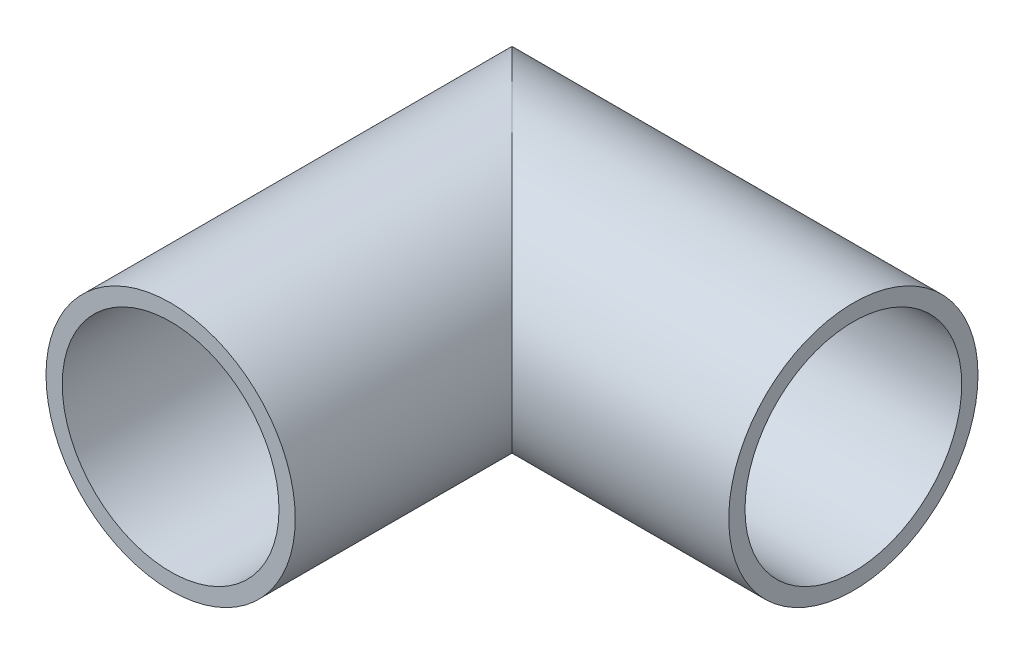
from build123d import *

# Parameters (mm, degrees)
SKETCH3_R                = 14.605
BOSS_EXTRUDE2_DEPTH      = 40.005
SKETCH4_R                = 14.605
BOSS_EXTRUDE3_DEPTH      = 40.005
BOSS_EXTRUDE4_REACH      = 60.43
BOSS_EXTRUDE4_END_RADIUS = 14.605
SKETCH5_R                = 14.605
SKETCH6_R                = 12.7
CUT_EXTRUDE1_DEPTH       = 40.005
SKETCH7_R                = 12.7
CUT_EXTRUDE2_DEPTH       = 40.005
CUT_EXTRUDE3_REACH       = 60.43
CUT_EXTRUDE3_END_RADIUS  = 12.7
SKETCH8_R                = 12.7


with BuildPart() as part:
    # Sketch3 → Boss-Extrude2 (new body)
    with BuildSketch(Plane.XY):
        Circle(SKETCH3_R)
    extrude(amount=BOSS_EXTRUDE2_DEPTH)

    # Sketch4 → Boss-Extrude3 (add)
    with BuildSketch(Plane(origin=(0, 0, 0), x_dir=(0, 0, -1), z_dir=(1, 0, 0))):
        Circle(SKETCH4_R)
    extrude(amount=BOSS_EXTRUDE3_DEPTH)

    # Boss-Extrude4: up to this cylinder (the profile starts inside it)
    boss_extrude4_end = Plane(origin=(0, 0, 0), z_dir=(0, 0, -1)) * Cylinder(BOSS_EXTRUDE4_END_RADIUS, 151.07, mode=Mode.PRIVATE)
    # Sketch5 → Boss-Extrude4 (add, up to the surface)
    with BuildSketch(Plane.ZY, mode=Mode.PRIVATE) as boss_extrude4_sk1:
        Circle(SKETCH5_R)
    boss_extrude4_tool1 = extrude(boss_extrude4_sk1.sketch, amount=BOSS_EXTRUDE4_REACH, mode=Mode.PRIVATE) & boss_extrude4_end
    add(boss_extrude4_tool1.solids().sort_by_distance((0, 0, 0))[0])

    # Sketch6 → Cut-Extrude1 (cut)
    with BuildSketch(Plane.XY.offset(40.005)):
        Circle(SKETCH6_R)
    extrude(amount=-CUT_EXTRUDE1_DEPTH, mode=Mode.SUBTRACT)

    # Sketch7 → Cut-Extrude2 (cut)
    with BuildSketch(Plane(origin=(40.005, 0, 0), x_dir=(0, 0, -1), z_dir=(1, 0, 0))):
        Circle(SKETCH7_R)
    extrude(amount=-CUT_EXTRUDE2_DEPTH, mode=Mode.SUBTRACT)

    # Cut-Extrude3: up to this cylinder (the profile starts inside it)
    cut_extrude3_end = Plane(origin=(0, 0, 0), z_dir=(0, 0, 1)) * Cylinder(CUT_EXTRUDE3_END_RADIUS, 147.26, mode=Mode.PRIVATE)
    # Sketch8 → Cut-Extrude3 (cut, up to the surface)
    with BuildSketch(Plane(origin=(0, 0, 0), x_dir=(0, 0, -1), z_dir=(1, 0, 0)), mode=Mode.PRIVATE) as cut_extrude3_sk1:
        Circle(SKETCH8_R)
    cut_extrude3_tool1 = extrude(cut_extrude3_sk1.sketch, amount=-CUT_EXTRUDE3_REACH, mode=Mode.PRIVATE) & cut_extrude3_end
    add(cut_extrude3_tool1.solids().sort_by_distance((0, 0, 0))[0], mode=Mode.SUBTRACT)


solid = part.part
